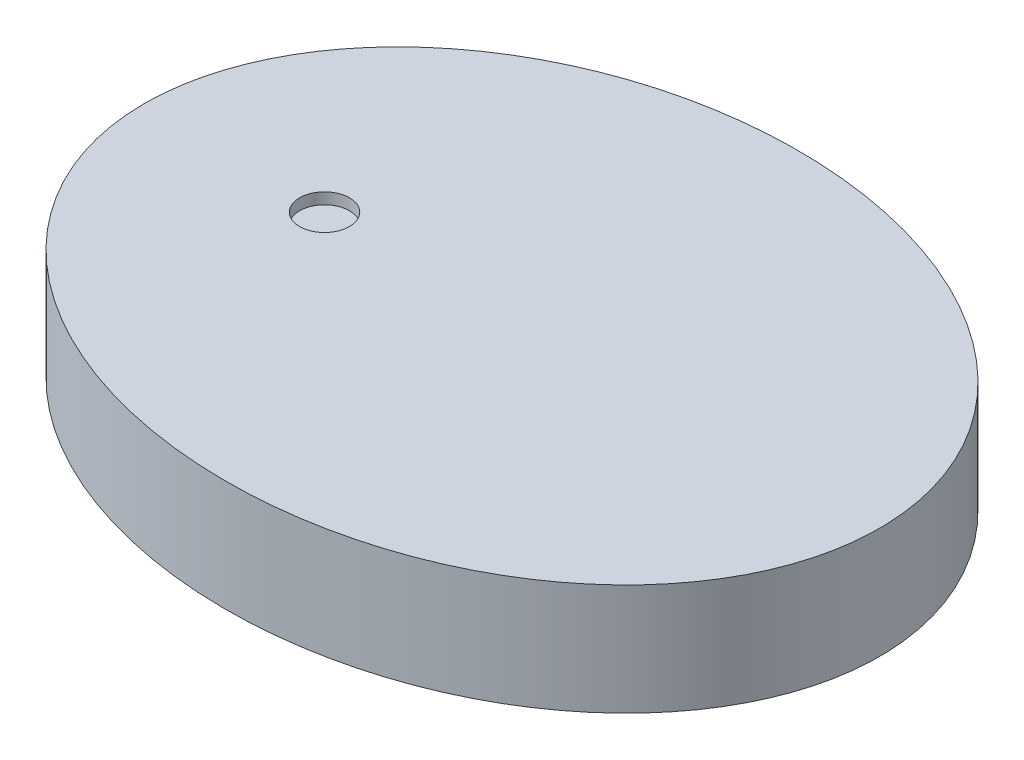
from build123d import *

# Parameters (mm, degrees)
SKETCH2_W                 = 49
SKETCH2_H                 = 20
BOSS_EXTRUDE1_DEPTH       = 10
SKETCH3_W                 = 30
SKETCH3_H                 = 3.02
CUT_EXTRUDE1_DEPTH        = 2
SKETCH4_W                 = 5
SKETCH4_H                 = 6
CUT_EXTRUDE2_DEPTH        = 5
SKETCH5_R                 = 7
CUT_EXTRUDE3_DEPTH        = 38.474986727
SKETCH12_W                = 5
SKETCH12_H                = 6
BOSS_EXTRUDE4_DEPTH       = 0.8
SKETCH14_W                = 29.5
SKETCH14_H                = 6
CUT_EXTRUDE6_DEPTH        = 42.177221974
SKETCH20_W                = 5
SKETCH20_H                = 6
BOSS_EXTRUDE6_DEPTH       = 4.2
SKETCH21_R                = 4.6
CUT_EXTRUDE8_DEPTH        = 0.5
SKETCH22_R                = 3.825
CUT_EXTRUDE9_DEPTH        = 4
SKETCH24_R                = 4.6
SKETCH24_R_2              = 4.25
CUT_EXTRUDE11_DEPTH       = 1
BOSS_EXTRUDE9_START       = 8
SKETCH26_R                = 5.065639608
SKETCH26_R_2              = 3.825
BOSS_EXTRUDE9_DEPTH       = 8
SKETCH27_R                = 7
SKETCH27_R_2              = 4.6
CUT_EXTRUDE12_DEPTH       = 1
FILLET1_R                 = 0.5
SKETCH56_R                = 2
CUT_EXTRUDE13_DEPTH       = 2
SKETCH57_W                = 3
SKETCH57_H                = 6
BOSS_EXTRUDE19_DEPTH      = 5.3
CUT_EXTRUDE14_REACH       = 50.729
SKETCH58_R                = 1.5
FILLET2_R                 = 0.3
FILLET3_R                 = 0.8
SKETCH60_W                = 19
SKETCH60_H                = 4
BOSS_EXTRUDE21_DEPTH      = 1
SKETCH59_W                = 22.86
SKETCH59_H                = 13
BOSS_EXTRUDE20_DEPTH      = 11
CUT_EXTRUDE15_REACH       = 49.914
SKETCH61_R                = 2.5
FILLET4_R                 = 4
BOSS_EXTRUDE23_DEPTH      = 11.397463213
BOSS_EXTRUDE23_DEPTH_BACK = 0.01612128
SKETCH63_RX               = 37.789005123
SKETCH63_RY               = 29.417488172
SKETCH66_R                = 2.560598318
CUT_EXTRUDE16_DEPTH       = 1.153986273


with BuildPart() as part:
    # Sketch2 → Boss-Extrude1 (new body)
    with BuildSketch(Plane(origin=(0, 0, 0), x_dir=(1, 0, 0), z_dir=(0, 1, 0))):
        with Locations((10.076923077, 3.557692308)):
            Rectangle(SKETCH2_W, SKETCH2_H)
    extrude(amount=BOSS_EXTRUDE1_DEPTH)

    # Sketch3 → Cut-Extrude1 (cut)
    with BuildSketch(Plane.XZ):
        with Locations((12.576923077, -3.557692308)):
            Rectangle(SKETCH3_W, SKETCH3_H)
    extrude(amount=-CUT_EXTRUDE1_DEPTH, mode=Mode.SUBTRACT)

    # Sketch4 → Cut-Extrude2 (cut)
    with BuildSketch(Plane.XZ):
        with Locations((-4.923076923, -3.547692308)):
            Rectangle(SKETCH4_W, SKETCH4_H)
    extrude(amount=-CUT_EXTRUDE2_DEPTH, mode=Mode.SUBTRACT)

    # Sketch5 → Cut-Extrude3 (cut, through all)
    with BuildSketch(Plane.XZ.offset(-5)):
        with Locations(Location((-4.923076923, -3.552692308, 0), (0, 0, 270))):
            Circle(SKETCH5_R)
    extrude(amount=-CUT_EXTRUDE3_DEPTH, mode=Mode.SUBTRACT)

    # Sketch12 → Boss-Extrude4 (add)
    with BuildSketch(Plane.XZ):
        with Locations((-4.923076923, -3.547692308)):
            Rectangle(SKETCH12_W, SKETCH12_H)
    extrude(amount=-BOSS_EXTRUDE4_DEPTH)

    # Sketch14 → Cut-Extrude6 (cut, through all)
    with BuildSketch(Plane.XY.offset(6.442307692)):
        with Locations((19.826923077, 7)):
            Rectangle(SKETCH14_W, SKETCH14_H)
    extrude(amount=-CUT_EXTRUDE6_DEPTH, mode=Mode.SUBTRACT)

    # Sketch20 → Boss-Extrude6 (add)
    with BuildSketch(Plane(origin=(0, 0.8, 0), x_dir=(1, 0, 0), z_dir=(0, 1, 0))):
        with Locations((-4.923076923, 3.547692308)):
            Rectangle(SKETCH20_W, SKETCH20_H)
    extrude(amount=BOSS_EXTRUDE6_DEPTH)

    # Sketch21 → Cut-Extrude8 (cut)
    with BuildSketch(Plane(origin=(0, 5, 0), x_dir=(1, 0, 0), z_dir=(0, 1, 0))):
        with Locations(Location((-4.923076923, 3.552692308, 0), (0, 0, 270))):
            Circle(SKETCH21_R)
    extrude(amount=-CUT_EXTRUDE8_DEPTH, mode=Mode.SUBTRACT)

    # Sketch22 → Cut-Extrude9 (cut)
    with BuildSketch(Plane(origin=(0, 4.5, 0), x_dir=(1, 0, 0), z_dir=(0, 1, 0))):
        with Locations(Location((-4.923076923, 3.552692308, 0), (0, 0, 270))):
            Circle(SKETCH22_R)
    extrude(amount=-CUT_EXTRUDE9_DEPTH, mode=Mode.SUBTRACT)

    # Sketch24 → Cut-Extrude11 (cut)
    with BuildSketch(Plane(origin=(0, 5, 0), x_dir=(1, 0, 0), z_dir=(0, 1, 0))):
        with Locations(Location((-4.923076923, 3.552692308, 0), (0, 0, 270))):
            Circle(SKETCH24_R)
        with Locations(Location((-4.923076923, 3.552692308, 0), (0, 0, 270))):
            Circle(SKETCH24_R_2, mode=Mode.SUBTRACT)
    extrude(amount=-CUT_EXTRUDE11_DEPTH, mode=Mode.SUBTRACT)

    # Sketch26 → Boss-Extrude9 (add)
    with BuildSketch(Plane(origin=(0, 4.5, 0), x_dir=(1, 0, 0), z_dir=(0, 1, 0)).offset(BOSS_EXTRUDE9_START)):
        with Locations(Location((-4.923076923, 3.552692308, 0), (0, 0, 90))):
            Circle(SKETCH26_R)
        with Locations(Location((-4.923076923, 3.552692308, 0), (0, 0, 270))):
            Circle(SKETCH26_R_2, mode=Mode.SUBTRACT)
    extrude(amount=-BOSS_EXTRUDE9_DEPTH)

    # Sketch27 → Cut-Extrude12 (cut)
    with BuildSketch(Plane(origin=(0, 5, 0), x_dir=(1, 0, 0), z_dir=(0, 1, 0))):
        with Locations(Location((-4.923076923, 3.552692308, 0), (0, 0, 90))):
            Circle(SKETCH27_R)
        with Locations(Location((-4.923076923, 3.552692308, 0), (0, 0, 270))):
            Circle(SKETCH27_R_2, mode=Mode.SUBTRACT)
    extrude(amount=-CUT_EXTRUDE12_DEPTH, mode=Mode.SUBTRACT)

    # Fillet1
    fillet1_edges = [part.edges().sort_by_distance(p)[0] for p in [
        (5.076923077, 4, -3.557692308),
    ]]
    fillet(fillet1_edges, radius=FILLET1_R)

    # Sketch56 → Cut-Extrude13 (cut)
    with BuildSketch(Plane.XZ):
        with Locations((28.926923077, -3.557692308)):
            Circle(SKETCH56_R)
    extrude(amount=-CUT_EXTRUDE13_DEPTH, mode=Mode.SUBTRACT)

    # Sketch57 → Boss-Extrude19 (add)
    with BuildSketch(Plane(origin=(0, 4, 0), x_dir=(1, 0, 0), z_dir=(0, 1, 0))):
        with Locations((29.181923077, 3.557692308)):
            Rectangle(SKETCH57_W, SKETCH57_H)
        with Locations((22.931923077, 3.557692308)):
            Rectangle(SKETCH57_W, SKETCH57_H)
    extrude(amount=BOSS_EXTRUDE19_DEPTH)

    # Cut-Extrude14: up to this face of the body (flat: up to its plane)
    cut_extrude14_end = Plane(part.part.faces().sort_by_distance((21.431923077, 6.65, -3.557692308))[0])
    # Sketch58 → Cut-Extrude14 (cut, up to the picked face)
    with BuildSketch(Plane(origin=(30.681923077, 0, 0), x_dir=(0, 0, -1), z_dir=(1, 0, 0)), mode=Mode.PRIVATE) as cut_extrude14_sk1:
        with Locations(Location((3.557692308, 7, 0), (0, 0, 180))):
            Circle(SKETCH58_R)
    cut_extrude14_tool1 = split(extrude(cut_extrude14_sk1.sketch, amount=-CUT_EXTRUDE14_REACH, mode=Mode.PRIVATE), bisect_by=cut_extrude14_end, keep=Keep.BOTH, mode=Mode.PRIVATE)
    add(cut_extrude14_tool1.solids().sort_by(Axis((30.681923, 7, -3.557692), (-1, 0, 0)))[0], mode=Mode.SUBTRACT)

    # Fillet2
    fillet2_edges = [part.edges().sort_by_distance(p)[0] for p in [
        (27.681923077, 9.3, -3.557692308),
        (24.431923077, 9.3, -3.557692308),
    ]]
    fillet(fillet2_edges, radius=FILLET2_R)

    # Fillet3
    fillet3_edges = [part.edges().sort_by_distance(p)[0] for p in [
        (30.681923077, 4, -3.557692308),
        (30.681923077, 6.65, -0.557692308),
        (29.181923077, 4, -6.557692308),
        (30.681923077, 6.65, -6.557692308),
        (29.181923077, 4, -0.557692308),
        (21.431923077, 6.65, -6.557692308),
        (21.431923077, 6.65, -0.557692308),
        (22.931923077, 4, -6.557692308),
        (21.431923077, 4, -3.557692308),
        (22.931923077, 4, -0.557692308),
    ]]
    fillet(fillet3_edges, radius=FILLET3_R)

    # Sketch60 → Boss-Extrude21 (add)
    with BuildSketch(Plane(origin=(0, 0, -13.557692308), x_dir=(-1, 0, 0), z_dir=(0, 0, -1))):
        with Locations((-25.076923077, 2)):
            Rectangle(SKETCH60_W, SKETCH60_H)
    boss_extrude21 = extrude(amount=BOSS_EXTRUDE21_DEPTH)

    # Sketch59 → Boss-Extrude20 (add)
    with BuildSketch(Plane(origin=(0, 0, -14.557692308), x_dir=(-1, 0, 0), z_dir=(0, 0, -1))):
        with Locations((-26.956923077, 3.5)):
            Rectangle(SKETCH59_W, SKETCH59_H)
    boss_extrude20 = extrude(amount=BOSS_EXTRUDE20_DEPTH)

    # Mirror4: Boss-Extrude21, Boss-Extrude20 across plane
    add(boss_extrude21.mirror(Plane(origin=(0, 0, -3.557692308), x_dir=(1, 0, 0), z_dir=(0, 0, -1))))
    add(boss_extrude20.mirror(Plane(origin=(0, 0, -3.557692308), x_dir=(1, 0, 0), z_dir=(0, 0, -1))))

    # Sketch61 → Cut-Extrude15 (cut, up to next)
    with BuildSketch(Plane(origin=(0, 10, 0), x_dir=(1, 0, 0), z_dir=(0, 1, 0)), mode=Mode.PRIVATE) as cut_extrude15_sk1:
        with Locations(Location((20.406923077, 20.207692308, 0), (0, 0, 270))):
            Circle(SKETCH61_R)
    cut_extrude15_tool1 = extrude(cut_extrude15_sk1.sketch, amount=-CUT_EXTRUDE15_REACH, mode=Mode.PRIVATE) & part.part
    # Sketch61 → Cut-Extrude15 (cut, up to next)
    with BuildSketch(Plane(origin=(0, 10, 0), x_dir=(1, 0, 0), z_dir=(0, 1, 0)), mode=Mode.PRIVATE) as cut_extrude15_sk2:
        with Locations(Location((31.706923077, 20.207692308, 0), (0, 0, 270))):
            Circle(SKETCH61_R)
    cut_extrude15_tool2 = extrude(cut_extrude15_sk2.sketch, amount=-CUT_EXTRUDE15_REACH, mode=Mode.PRIVATE) & part.part
    # Sketch61 → Cut-Extrude15 (cut, up to next)
    with BuildSketch(Plane(origin=(0, 10, 0), x_dir=(1, 0, 0), z_dir=(0, 1, 0)), mode=Mode.PRIVATE) as cut_extrude15_sk3:
        with Locations(Location((31.706923077, -13.092307692, 0), (0, 0, 90))):
            Circle(SKETCH61_R)
    cut_extrude15_tool3 = extrude(cut_extrude15_sk3.sketch, amount=-CUT_EXTRUDE15_REACH, mode=Mode.PRIVATE) & part.part
    # Sketch61 → Cut-Extrude15 (cut, up to next)
    with BuildSketch(Plane(origin=(0, 10, 0), x_dir=(1, 0, 0), z_dir=(0, 1, 0)), mode=Mode.PRIVATE) as cut_extrude15_sk4:
        with Locations(Location((20.406923077, -13.092307692, 0), (0, 0, 90))):
            Circle(SKETCH61_R)
    cut_extrude15_tool4 = extrude(cut_extrude15_sk4.sketch, amount=-CUT_EXTRUDE15_REACH, mode=Mode.PRIVATE) & part.part
    add(cut_extrude15_tool1.solids().sort_by_distance((20.406923, 10, -20.207692))[0], mode=Mode.SUBTRACT)
    add(cut_extrude15_tool2.solids().sort_by_distance((31.706923, 10, -20.207692))[0], mode=Mode.SUBTRACT)
    add(cut_extrude15_tool3.solids().sort_by_distance((31.706923, 10, 13.092308))[0], mode=Mode.SUBTRACT)
    add(cut_extrude15_tool4.solids().sort_by_distance((20.406923, 10, 13.092308))[0], mode=Mode.SUBTRACT)

    # Fillet4
    # the kernel refuses this fillet: 4 mm, written as the material it takes off along each edge
    with BuildSketch(Plane(origin=(38.386923077, 20, -25.557692308), x_dir=(0, 0, 1), z_dir=(0, -1, 0)), Plane(origin=(15.526923077, -13, -25.557692308), x_dir=(0, 0, 1), z_dir=(0, 1, 0)), Plane(origin=(15.526923077, -13, 18.442307692), x_dir=(1, 0, 0), z_dir=(0, 1, 0))) as fillet4_piece_1:
        with BuildLine():
            CenterArc((FILLET4_R, FILLET4_R), FILLET4_R, 180, 90)
            Line((0, FILLET4_R), (0, 0))
            Line((0, 0), (FILLET4_R, 0))
        make_face()
    extrude(amount=33, mode=Mode.SUBTRACT)
    with BuildSketch(Plane(origin=(38.386923077, 20, -14.557692308), x_dir=(-1, 0, 0), z_dir=(0, -1, 0))) as fillet4_piece_2_section:
        with BuildLine():
            CenterArc((FILLET4_R, FILLET4_R), FILLET4_R, 180, 90)
            Line((0, FILLET4_R), (0, 0))
            Line((0, 0), (FILLET4_R, 0))
        make_face()
    fillet4_piece_2 = extrude(amount=33, mode=Mode.PRIVATE)
    fillet4_piece_2 = split(fillet4_piece_2, bisect_by=Plane(origin=(34.576923077, 12, -14.51845576), z_dir=(-1, 0, 0)), keep=Keep.TOP, mode=Mode.PRIVATE)
    fillet4_piece_2 = split(fillet4_piece_2, bisect_by=Plane(origin=(34.482800084, 4, -14.51845576), z_dir=(0, 1, 0)), keep=Keep.TOP, mode=Mode.PRIVATE)
    add(fillet4_piece_2, mode=Mode.SUBTRACT)
    with BuildSketch(Plane(origin=(38.386923077, 20, -14.557692308), x_dir=(-1, 0, 0), z_dir=(0, -1, 0))) as fillet4_piece_3_section:
        with BuildLine():
            CenterArc((FILLET4_R, FILLET4_R), FILLET4_R, 180, 90)
            Line((0, FILLET4_R), (0, 0))
            Line((0, 0), (FILLET4_R, 0))
        make_face()
    fillet4_piece_3 = extrude(amount=33, mode=Mode.PRIVATE)
    fillet4_piece_3 = split(fillet4_piece_3, bisect_by=Plane(origin=(34.576923077, 12, -15.466872512), z_dir=(1, 0, 0)), keep=Keep.TOP, mode=Mode.PRIVATE)
    fillet4_piece_3 = split(fillet4_piece_3, bisect_by=Plane(origin=(37.49276705, 4, -15.466872512), z_dir=(0, 1, 0)), keep=Keep.TOP, mode=Mode.PRIVATE)
    add(fillet4_piece_3, mode=Mode.SUBTRACT)
    with BuildSketch(Plane(origin=(38.386923077, 20, -14.557692308), x_dir=(-1, 0, 0), z_dir=(0, -1, 0))) as fillet4_piece_4_section:
        with BuildLine():
            CenterArc((FILLET4_R, FILLET4_R), FILLET4_R, 180, 90)
            Line((0, FILLET4_R), (0, 0))
            Line((0, 0), (FILLET4_R, 0))
        make_face()
    fillet4_piece_4 = extrude(amount=33, mode=Mode.PRIVATE)
    fillet4_piece_4 = split(fillet4_piece_4, bisect_by=Plane(origin=(34.576923077, 2, -15.466872512), z_dir=(1, 0, 0)), keep=Keep.TOP, mode=Mode.PRIVATE)
    fillet4_piece_4 = split(fillet4_piece_4, bisect_by=Plane(origin=(37.49276705, 0, -15.466872512), z_dir=(0, 1, 0)), keep=Keep.TOP, mode=Mode.PRIVATE)
    fillet4_piece_4 = split(fillet4_piece_4, bisect_by=Plane(origin=(37.49276705, 4, -15.466872512), z_dir=(0, -1, 0)), keep=Keep.TOP, mode=Mode.PRIVATE)
    add(fillet4_piece_4, mode=Mode.SUBTRACT)
    with BuildSketch(Plane(origin=(38.386923077, 20, -14.557692308), x_dir=(-1, 0, 0), z_dir=(0, -1, 0))) as fillet4_piece_5_section:
        with BuildLine():
            CenterArc((FILLET4_R, FILLET4_R), FILLET4_R, 180, 90)
            Line((0, FILLET4_R), (0, 0))
            Line((0, 0), (FILLET4_R, 0))
        make_face()
    fillet4_piece_5 = extrude(amount=33, mode=Mode.PRIVATE)
    fillet4_piece_5 = split(fillet4_piece_5, bisect_by=Plane(origin=(34.576923077, -6.5, -14.51845576), z_dir=(-1, 0, 0)), keep=Keep.TOP, mode=Mode.PRIVATE)
    fillet4_piece_5 = split(fillet4_piece_5, bisect_by=Plane(origin=(34.482800084, 0, -14.51845576), z_dir=(0, -1, 0)), keep=Keep.TOP, mode=Mode.PRIVATE)
    add(fillet4_piece_5, mode=Mode.SUBTRACT)
    with BuildSketch(Plane(origin=(38.386923077, 20, -14.557692308), x_dir=(-1, 0, 0), z_dir=(0, -1, 0))) as fillet4_piece_6_section:
        with BuildLine():
            CenterArc((FILLET4_R, FILLET4_R), FILLET4_R, 180, 90)
            Line((0, FILLET4_R), (0, 0))
            Line((0, 0), (FILLET4_R, 0))
        make_face()
    fillet4_piece_6 = extrude(amount=33, mode=Mode.PRIVATE)
    fillet4_piece_6 = split(fillet4_piece_6, bisect_by=Plane(origin=(34.576923077, -6.5, -15.466872512), z_dir=(1, 0, 0)), keep=Keep.TOP, mode=Mode.PRIVATE)
    fillet4_piece_6 = split(fillet4_piece_6, bisect_by=Plane(origin=(37.49276705, 0, -15.466872512), z_dir=(0, -1, 0)), keep=Keep.TOP, mode=Mode.PRIVATE)
    add(fillet4_piece_6, mode=Mode.SUBTRACT)
    with BuildSketch(Plane(origin=(38.386923077, 20, 7.442307692), x_dir=(0, 0, 1), z_dir=(0, -1, 0))) as fillet4_piece_7_section:
        with BuildLine():
            CenterArc((FILLET4_R, FILLET4_R), FILLET4_R, 180, 90)
            Line((0, FILLET4_R), (0, 0))
            Line((0, 0), (FILLET4_R, 0))
        make_face()
    fillet4_piece_7 = extrude(amount=33, mode=Mode.PRIVATE)
    fillet4_piece_7 = split(fillet4_piece_7, bisect_by=Plane(origin=(34.576923077, 12, 8.351487897), z_dir=(1, 0, 0)), keep=Keep.TOP, mode=Mode.PRIVATE)
    fillet4_piece_7 = split(fillet4_piece_7, bisect_by=Plane(origin=(37.49276705, 4, 8.351487897), z_dir=(0, 1, 0)), keep=Keep.TOP, mode=Mode.PRIVATE)
    add(fillet4_piece_7, mode=Mode.SUBTRACT)
    with BuildSketch(Plane(origin=(38.386923077, 20, 7.442307692), x_dir=(0, 0, 1), z_dir=(0, -1, 0))) as fillet4_piece_8_section:
        with BuildLine():
            CenterArc((FILLET4_R, FILLET4_R), FILLET4_R, 180, 90)
            Line((0, FILLET4_R), (0, 0))
            Line((0, 0), (FILLET4_R, 0))
        make_face()
    fillet4_piece_8 = extrude(amount=33, mode=Mode.PRIVATE)
    fillet4_piece_8 = split(fillet4_piece_8, bisect_by=Plane(origin=(34.576923077, 12, 7.403071145), z_dir=(-1, 0, 0)), keep=Keep.TOP, mode=Mode.PRIVATE)
    fillet4_piece_8 = split(fillet4_piece_8, bisect_by=Plane(origin=(34.482800084, 4, 7.403071145), z_dir=(0, 1, 0)), keep=Keep.TOP, mode=Mode.PRIVATE)
    add(fillet4_piece_8, mode=Mode.SUBTRACT)
    with BuildSketch(Plane(origin=(38.386923077, 20, 7.442307692), x_dir=(0, 0, 1), z_dir=(0, -1, 0))) as fillet4_piece_9_section:
        with BuildLine():
            CenterArc((FILLET4_R, FILLET4_R), FILLET4_R, 180, 90)
            Line((0, FILLET4_R), (0, 0))
            Line((0, 0), (FILLET4_R, 0))
        make_face()
    fillet4_piece_9 = extrude(amount=33, mode=Mode.PRIVATE)
    fillet4_piece_9 = split(fillet4_piece_9, bisect_by=Plane(origin=(34.576923077, 2, 8.351487897), z_dir=(1, 0, 0)), keep=Keep.TOP, mode=Mode.PRIVATE)
    fillet4_piece_9 = split(fillet4_piece_9, bisect_by=Plane(origin=(37.49276705, 0, 8.351487897), z_dir=(0, 1, 0)), keep=Keep.TOP, mode=Mode.PRIVATE)
    fillet4_piece_9 = split(fillet4_piece_9, bisect_by=Plane(origin=(37.49276705, 4, 8.351487897), z_dir=(0, -1, 0)), keep=Keep.TOP, mode=Mode.PRIVATE)
    add(fillet4_piece_9, mode=Mode.SUBTRACT)
    with BuildSketch(Plane(origin=(38.386923077, 20, 7.442307692), x_dir=(0, 0, 1), z_dir=(0, -1, 0))) as fillet4_piece_10_section:
        with BuildLine():
            CenterArc((FILLET4_R, FILLET4_R), FILLET4_R, 180, 90)
            Line((0, FILLET4_R), (0, 0))
            Line((0, 0), (FILLET4_R, 0))
        make_face()
    fillet4_piece_10 = extrude(amount=33, mode=Mode.PRIVATE)
    fillet4_piece_10 = split(fillet4_piece_10, bisect_by=Plane(origin=(34.576923077, -6.5, 8.351487897), z_dir=(1, 0, 0)), keep=Keep.TOP, mode=Mode.PRIVATE)
    fillet4_piece_10 = split(fillet4_piece_10, bisect_by=Plane(origin=(37.49276705, 0, 8.351487897), z_dir=(0, -1, 0)), keep=Keep.TOP, mode=Mode.PRIVATE)
    add(fillet4_piece_10, mode=Mode.SUBTRACT)
    with BuildSketch(Plane(origin=(38.386923077, 20, 7.442307692), x_dir=(0, 0, 1), z_dir=(0, -1, 0))) as fillet4_piece_11_section:
        with BuildLine():
            CenterArc((FILLET4_R, FILLET4_R), FILLET4_R, 180, 90)
            Line((0, FILLET4_R), (0, 0))
            Line((0, 0), (FILLET4_R, 0))
        make_face()
    fillet4_piece_11 = extrude(amount=33, mode=Mode.PRIVATE)
    fillet4_piece_11 = split(fillet4_piece_11, bisect_by=Plane(origin=(34.576923077, -6.5, 7.403071145), z_dir=(-1, 0, 0)), keep=Keep.TOP, mode=Mode.PRIVATE)
    fillet4_piece_11 = split(fillet4_piece_11, bisect_by=Plane(origin=(34.482800084, 0, 7.403071145), z_dir=(0, -1, 0)), keep=Keep.TOP, mode=Mode.PRIVATE)
    add(fillet4_piece_11, mode=Mode.SUBTRACT)
    with BuildSketch(Plane(origin=(38.386923077, 20, 18.442307692), x_dir=(0, 0, -1), z_dir=(0, -1, 0))) as fillet4_piece_12:
        with BuildLine():
            CenterArc((FILLET4_R, -FILLET4_R), FILLET4_R, 90, 90)
            Line((0, -FILLET4_R), (0, 0))
            Line((0, 0), (FILLET4_R, 0))
        make_face()
    extrude(amount=33, mode=Mode.SUBTRACT)
    with BuildSketch(Plane(origin=(-14.423076923, -10, 6.442307692), x_dir=(1, 0, 0), z_dir=(0, 1, 0))) as fillet4_piece_13:
        with BuildLine():
            CenterArc((FILLET4_R, FILLET4_R), FILLET4_R, 180, 90)
            Line((0, FILLET4_R), (0, 0))
            Line((0, 0), (FILLET4_R, 0))
        make_face()
    extrude(amount=30, mode=Mode.SUBTRACT)
    with BuildSketch(Plane(origin=(-14.423076923, -10, -13.557692308), x_dir=(1, 0, 0), z_dir=(0, 1, 0))) as fillet4_piece_14:
        with BuildLine():
            CenterArc((FILLET4_R, -FILLET4_R), FILLET4_R, 90, 90)
            Line((0, -FILLET4_R), (0, 0))
            Line((0, 0), (FILLET4_R, 0))
        make_face()
    extrude(amount=30, mode=Mode.SUBTRACT)


with BuildPart() as body_2:
    # Sketch63 → Boss-Extrude23 (new, two sides: drawn at the far end of the back side and taken through both)
    with BuildSketch(Plane(origin=(0, 4, 0), x_dir=(-1, 0, 0), z_dir=(0, 1, 0)).offset(-BOSS_EXTRUDE23_DEPTH_BACK)):
        with Locations((-14.019138215, -3.634653101)):
            Ellipse(SKETCH63_RX, SKETCH63_RY)
    extrude(amount=BOSS_EXTRUDE23_DEPTH + BOSS_EXTRUDE23_DEPTH_BACK)

    # Combine1: cut part
    add(part.part, mode=Mode.SUBTRACT)

    # Sketch66 → Cut-Extrude16 (cut)
    with BuildSketch(Plane(origin=(0, 15.397463213, 0), x_dir=(1, 0, 0), z_dir=(0, 1, 0))):
        with Locations(Location((-4.844286355, 3.234721838, 0), (0, 0, 270))):
            Circle(SKETCH66_R)
    extrude(amount=-CUT_EXTRUDE16_DEPTH, mode=Mode.SUBTRACT)


solid = body_2.part
